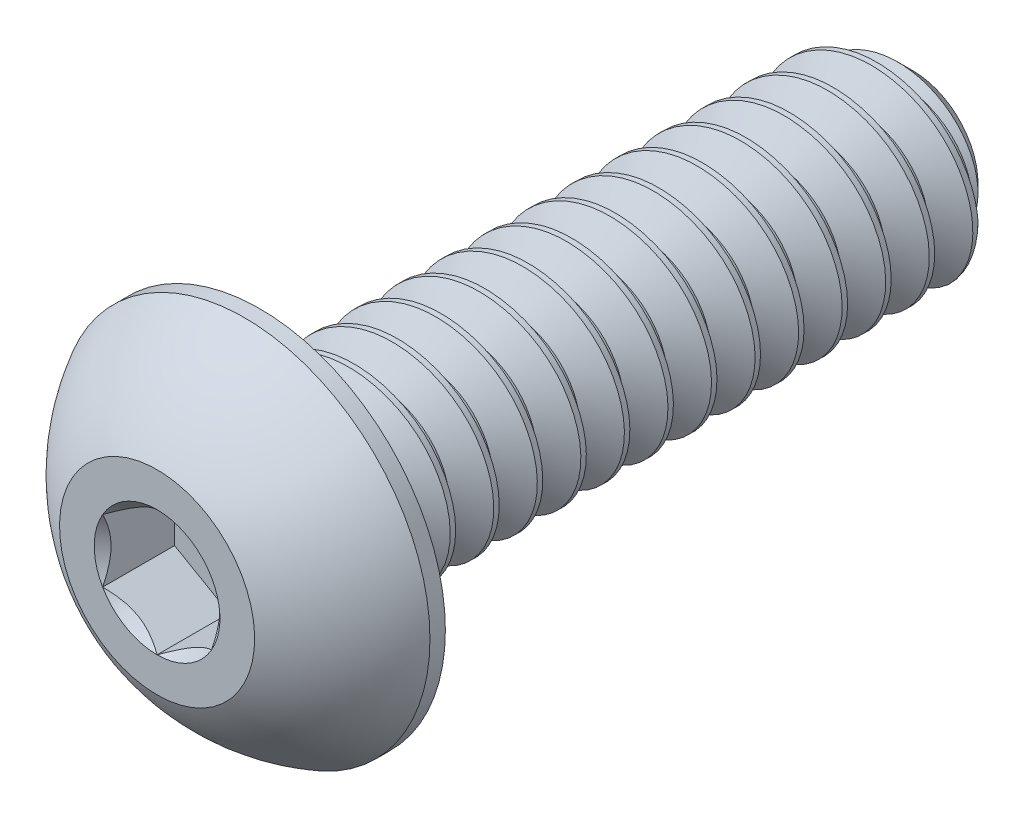
from build123d import *

# Parameters (mm, degrees)
SKETCH1_W          = 9.525
SKETCH1_H          = 1.4224
CHAMFER1_SIZE      = 0.47625
CUT_SWEEP1_PITCH   = 0.635
CUT_EXTRUDE2_DEPTH = 1.04902


with BuildPart() as part:
    # Sketch1 → Revolve1 (revolve)
    with BuildSketch(Plane(origin=(0, 0, 0), x_dir=(0, 0, -1), z_dir=(1, 0, 0))):
        with Locations((6.2611, 0.7112)):
            Rectangle(SKETCH1_W, SKETCH1_H)
    revolve(axis=Axis((0, 0, -11.0236), (0, 0, 1)))

    # Chamfer1
    chamfer1_edges = [part.edges().sort_by_distance(p)[0] for p in [
        (0, -1.4224, -11.0236),
    ]]
    chamfer(chamfer1_edges, length=CHAMFER1_SIZE)

    # Cut-Sweep1: the profile of Sketch2 profile screwed along a right-hand helix of 16 turns, 6 arcs to a turn; built about Z, then put on its axis
    cut_sweep1_z = Axis((0, 0, 0), (0, 0, 1))
    cut_sweep1_corners = [(1.4227, 0, 0.000173205), (1.4227, 0, -0.555798205), (1.009955401, 0, -0.3175), (1.009955401, 0, -0.238125)]
    with BuildLine(mode=Mode.PRIVATE) as cut_sweep1_profile:
        Line(cut_sweep1_corners[0], cut_sweep1_corners[1])
        Line(cut_sweep1_corners[1], cut_sweep1_corners[2])
        Line(cut_sweep1_corners[2], cut_sweep1_corners[3])
        Line(cut_sweep1_corners[3], cut_sweep1_corners[0])
    cut_sweep1_cap = Face(cut_sweep1_profile.wire())
    cut_sweep1_turn_angles = [0, 30, 60, 90, 120, 150, 180, 210, 240, 270, 300, 330, 360]
    cut_sweep1_turn_weights = [1, 0.8660254037844387, 1, 0.8660254037844387, 1, 0.8660254037844387, 1, 0.8660254037844387, 1, 0.8660254037844387, 1, 0.8660254037844387, 1]
    cut_sweep1_turn_rails = [Edge.make_bspline([Vector(p[0], p[1], 0).rotate(cut_sweep1_z, cut_sweep1_turn_angles[k]) / cut_sweep1_turn_weights[k] + Vector(0, 0, p[2] + CUT_SWEEP1_PITCH * cut_sweep1_turn_angles[k] / 360) for k in range(13)], [0, 0, 0, 1, 1, 2, 2, 3, 3, 4, 4, 5, 5, 6, 6, 6], 2, cut_sweep1_turn_weights) for p in cut_sweep1_corners]
    cut_sweep1_turn_sides = [Face.make_surface_from_curves(cut_sweep1_turn_rails[p[0]], cut_sweep1_turn_rails[p[1]]) for p in [(0, 1), (1, 2), (2, 3), (3, 0)]]
    cut_sweep1 = Plane(origin=(0, 0, -11.0236), x_dir=(0, 1, 0), z_dir=(0, 0, 1)) * Solid(Shell([*[p.moved(Location((0, 0, CUT_SWEEP1_PITCH * i))) for i in range(16) for p in cut_sweep1_turn_sides], cut_sweep1_cap, cut_sweep1_cap.rotate(cut_sweep1_z, 5760).moved(Location((0, 0, CUT_SWEEP1_PITCH * 5760 / 360)))]))
    add(cut_sweep1, mode=Mode.SUBTRACT)

    # Sketch7 → Revolve2 (revolve)
    with BuildSketch(Plane(origin=(0, 0, 0), x_dir=(0, 0, -1), z_dir=(1, 0, 0)), mode=Mode.PRIVATE) as revolve2_sk:
        with BuildLine():
            Line((1.27381, 2.7051), (1.4986, 2.7051))
            Line((1.4986, 2.7051), (1.4986, 0))
            Line((1.4986, 0), (0, 0))
            Line((0, 0), (0, 1.4224))
            ThreePointArc((0, 1.4224), (0.540190256, 2.159794444), (1.27381, 2.7051))
        make_face()
    revolve(revolve2_sk.sketch.rotate(Axis((0, 0, 0), (0, 0, -1)), 189.336081704), axis=Axis((0, 0, 0), (0, 0, -1)))

    # Sketch5 → Cut-Extrude2 (cut)
    with BuildSketch(Plane.XY):
        Polygon((0.79375, -0.458271776), (0.79375, 0.458271776), (0, 0.916543552), (-0.79375, 0.458271776), (-0.79375, -0.458271776), (0, -0.916543552), align=None)
    extrude(amount=-CUT_EXTRUDE2_DEPTH, mode=Mode.SUBTRACT)

    # Cut-Extrude3 cone 1 section (through the dimple's axis) → Cut-Extrude3 (revolve, cut)
    with BuildSketch(Plane(origin=(0, 0, 0), x_dir=(0, -1, 0), z_dir=(1, 0, 0))):
        Polygon((0, 0), (0.916543552, 0), (0, 0.916543552), align=None)
    revolve(axis=Axis((0, 0, 0), (0, 0, -1)), mode=Mode.SUBTRACT)


solid = part.part
